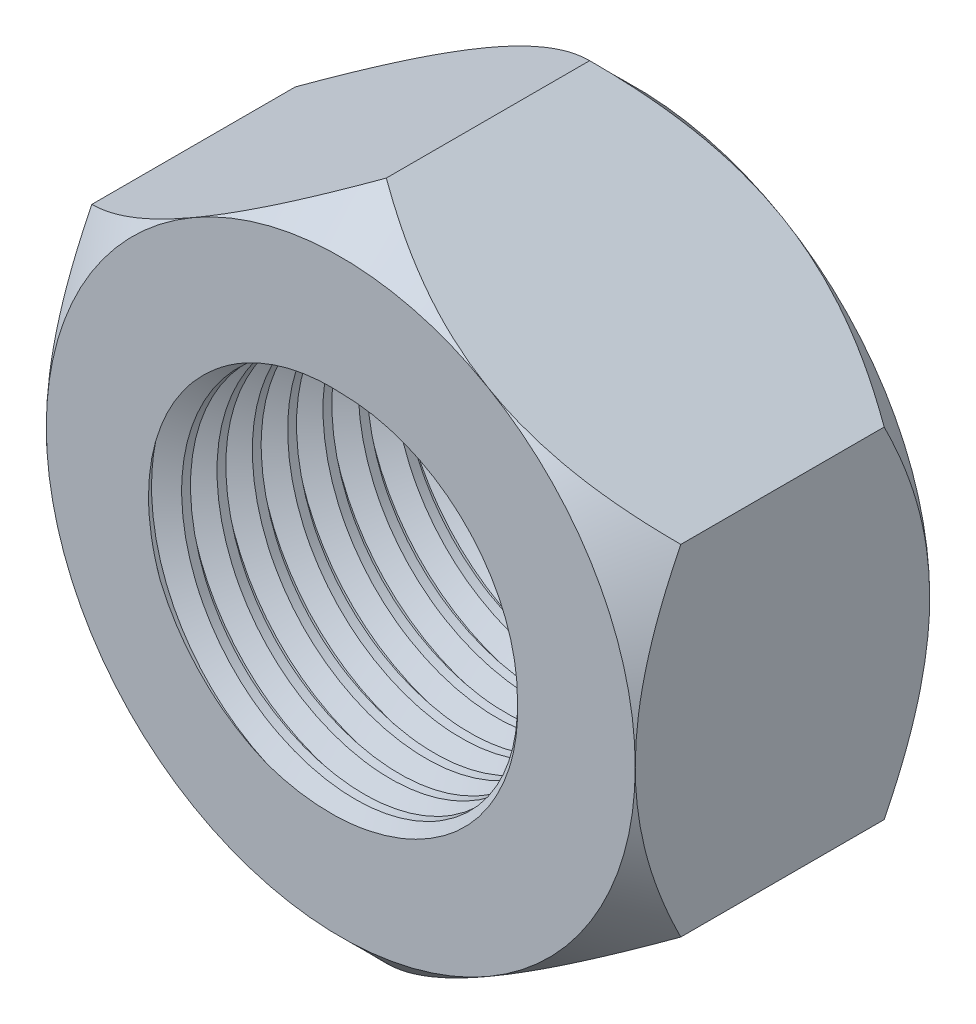
from build123d import *

# Parameters (mm, degrees)
BOSS_EXTRUDE1_DEPTH     = 3.333333333
SKETCH11_OUTSIDE_W      = 119.62
SKETCH11_OUTSIDE_H      = 121.682
SKETCH11_OUTSIDE_R      = 6.666666667
CUT_EXTRUDE5_DEPTH      = 50
CUT_EXTRUDE5_DRAFT      = -45
MIRROR1_COPY_1_SKETCH_W = 119.62
MIRROR1_COPY_1_SKETCH_H = 121.682
MIRROR1_COPY_1_SKETCH_R = 6.666666667
MIRROR1_COPY_1_DEPTH    = 50
MIRROR1_COPY_1_DRAFT    = -45
CUT_EXTRUDE6_REACH      = 14.172
SKETCH2_R               = 4
THREAD3_PITCH           = 0.8


with BuildPart() as part:
    # Sketch1 → Boss-Extrude1 (new, symmetric)
    with BuildSketch(Plane.XY):
        Polygon((0, 7.698003589), (-6.666666667, 3.849001795), (-6.666666667, -3.849001795), (0, -7.698003589), (6.666666667, -3.849001795), (6.666666667, 3.849001795), align=None)
    extrude(amount=BOSS_EXTRUDE1_DEPTH, both=True)


with BuildPart() as cut_extrude5_tool:
    # Sketch11 outside → Cut-Extrude5 (with draft: the straight prism first)
    with BuildSketch(Plane.XY.offset(3.333333333)):
        Rectangle(SKETCH11_OUTSIDE_W, SKETCH11_OUTSIDE_H)
        Circle(SKETCH11_OUTSIDE_R, mode=Mode.SUBTRACT)
    extrude(amount=-CUT_EXTRUDE5_DEPTH)
    # Cut-Extrude5: the draft: its side faces are tilted about the plane it starts from
    cut_extrude5_sides = [cut_extrude5_tool.faces().sort_by_distance(p)[0] for p in [
        (0, -60.841, -21.666666667),
        (59.81, 0, -21.666666667),
        (0, 60.841, -21.666666667),
        (-59.81, 0, -21.666666667),
        (-6.666666667, 0, -21.666666667),
    ]]
    draft(cut_extrude5_sides, Plane.XY.offset(3.333333333), CUT_EXTRUDE5_DRAFT)


with BuildPart() as part_1:
    add(part.part)

    # Cut-Extrude5: cut by cut_extrude5_tool
    add(cut_extrude5_tool.part, mode=Mode.SUBTRACT)


with BuildPart() as mirror1_copy_1_tool:
    # Mirror1 copy 1 sketch → Mirror1 copy 1 (with draft: the straight prism first)
    with BuildSketch(Plane(origin=(0, 0, -3.333333333), x_dir=(1, 0, 0), z_dir=(0, 0, -1))):
        Rectangle(MIRROR1_COPY_1_SKETCH_W, MIRROR1_COPY_1_SKETCH_H)
        Circle(MIRROR1_COPY_1_SKETCH_R, mode=Mode.SUBTRACT)
    extrude(amount=-MIRROR1_COPY_1_DEPTH)
    # Mirror1 copy 1: the draft: its side faces are tilted about the plane it starts from
    mirror1_copy_1_sides = [mirror1_copy_1_tool.faces().sort_by_distance(p)[0] for p in [
        (0, -60.841, 21.666666667),
        (59.81, 0, 21.666666667),
        (0, 60.841, 21.666666667),
        (-59.81, 0, 21.666666667),
        (-6.666666667, 0, 21.666666667),
    ]]
    draft(mirror1_copy_1_sides, Plane(origin=(0, 0, -3.333333333), x_dir=(1, 0, 0), z_dir=(0, 0, -1)), MIRROR1_COPY_1_DRAFT)


with BuildPart() as part_2:
    add(part_1.part)

    # Mirror1 copy 1: cut by mirror1_copy_1_tool
    add(mirror1_copy_1_tool.part, mode=Mode.SUBTRACT)

    # Sketch2 → Cut-Extrude6 (cut, up to next)
    with BuildSketch(Plane.XY.offset(3.333333333), mode=Mode.PRIVATE) as cut_extrude6_sk1:
        Circle(SKETCH2_R)
    cut_extrude6_tool1 = extrude(cut_extrude6_sk1.sketch, amount=-CUT_EXTRUDE6_REACH, mode=Mode.PRIVATE) & part_2.part
    add(cut_extrude6_tool1.solids().sort_by_distance((0, 0, 3.333333))[0], mode=Mode.SUBTRACT)

    # Thread3: the profile of Thread Profile3 profile screwed along a right-hand helix of 63.75 turns, 6 arcs to a turn; built about Z, then put on its axis
    thread3_z = Axis((0, 0, 0), (0, 0, 1))
    thread3_corners = [(3.9997, 0, -0.000173205), (4.4330127, 0, 0.249999999), (4.4330127, 0, 0.349999999), (3.9997, 0, 0.600173203)]
    with BuildLine(mode=Mode.PRIVATE) as thread3_profile:
        Line(thread3_corners[0], thread3_corners[1])
        Line(thread3_corners[1], thread3_corners[2])
        Line(thread3_corners[2], thread3_corners[3])
        Line(thread3_corners[3], thread3_corners[0])
    thread3_cap = Face(thread3_profile.wire())
    thread3_turn_angles = [0, 30, 60, 90, 120, 150, 180, 210, 240, 270, 300, 330, 360, 390, 420, 450, 480, 510, 540, 570, 600, 630, 660, 690, 720, 750, 780, 810, 840, 870, 900, 930, 960, 990, 1020, 1050, 1080]
    thread3_turn_weights = [1, 0.8660254037844387, 1, 0.8660254037844387, 1, 0.8660254037844387, 1, 0.8660254037844387, 1, 0.8660254037844387, 1, 0.8660254037844387, 1, 0.8660254037844387, 1, 0.8660254037844387, 1, 0.8660254037844387, 1, 0.8660254037844387, 1, 0.8660254037844387, 1, 0.8660254037844387, 1, 0.8660254037844387, 1, 0.8660254037844387, 1, 0.8660254037844387, 1, 0.8660254037844387, 1, 0.8660254037844387, 1, 0.8660254037844387, 1]
    thread3_turn_rails = [Edge.make_bspline([Vector(p[0], p[1], 0).rotate(thread3_z, thread3_turn_angles[k]) / thread3_turn_weights[k] + Vector(0, 0, p[2] + THREAD3_PITCH * thread3_turn_angles[k] / 360) for k in range(37)], [0, 0, 0, 1, 1, 2, 2, 3, 3, 4, 4, 5, 5, 6, 6, 7, 7, 8, 8, 9, 9, 10, 10, 11, 11, 12, 12, 13, 13, 14, 14, 15, 15, 16, 16, 17, 17, 18, 18, 18], 2, thread3_turn_weights) for p in thread3_corners]
    thread3_turn_sides = [Face.make_surface_from_curves(thread3_turn_rails[p[0]], thread3_turn_rails[p[1]]) for p in [(0, 1), (1, 2), (2, 3), (3, 0)]]
    thread3_last_angles = [22680, 22710, 22740, 22770, 22800, 22830, 22860, 22890, 22920, 22935, 22950]
    thread3_last_weights = [1, 0.8660254037844387, 1, 0.8660254037844387, 1, 0.8660254037844387, 1, 0.8660254037844387, 1, 0.9659258262890683, 1]
    thread3_last_rails = [Edge.make_bspline([Vector(p[0], p[1], 0).rotate(thread3_z, thread3_last_angles[k]) / thread3_last_weights[k] + Vector(0, 0, p[2] + THREAD3_PITCH * thread3_last_angles[k] / 360) for k in range(11)], [0, 0, 0, 1, 1, 2, 2, 3, 3, 4, 4, 5, 5, 5], 2, thread3_last_weights) for p in thread3_corners]
    thread3_last_sides = [Face.make_surface_from_curves(thread3_last_rails[p[0]], thread3_last_rails[p[1]]) for p in [(0, 1), (1, 2), (2, 3), (3, 0)]]
    thread3 = Plane(origin=(0, 0, 8.333333333), x_dir=(-1, 0, 0), z_dir=(0, 0, -1)) * Solid(Shell([*[p.moved(Location((0, 0, 3 * THREAD3_PITCH * i))) for i in range(21) for p in thread3_turn_sides], *thread3_last_sides, thread3_cap, thread3_cap.rotate(thread3_z, 22950).moved(Location((0, 0, THREAD3_PITCH * 22950 / 360)))]))
    add(thread3, mode=Mode.SUBTRACT)


solid = part_2.part
